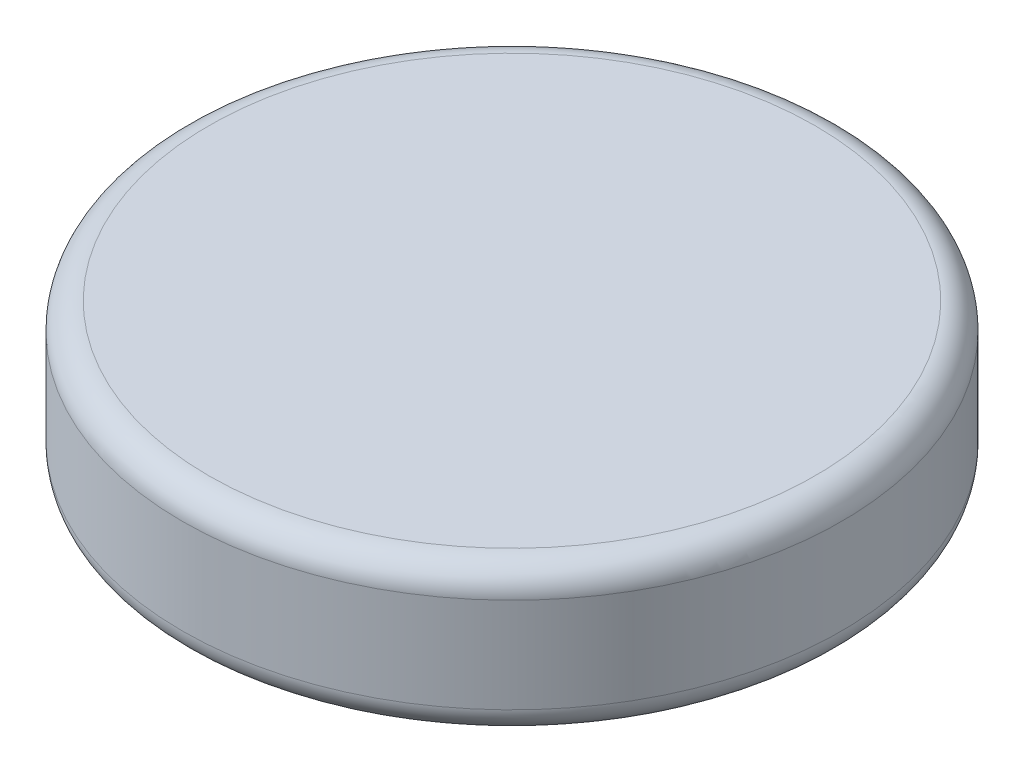
from build123d import *

# Parameters (mm, degrees)
SKETCH1_R           = 15.875
BOSS_EXTRUDE1_DEPTH = 7.112
FILLET1_R           = 1.27


with BuildPart() as part:
    # Sketch1 → Boss-Extrude1 (new body)
    with BuildSketch(Plane(origin=(0, 0, 0), x_dir=(1, 0, 0), z_dir=(0, 1, 0))):
        Circle(SKETCH1_R)
    extrude(amount=BOSS_EXTRUDE1_DEPTH)

    # Fillet1
    fillet1_edges = [part.edges().sort_by_distance(p)[0] for p in [
        (-15.875, 0, 0),
        (-15.875, 7.112, 0),
    ]]
    fillet(fillet1_edges, radius=FILLET1_R)


solid = part.part
